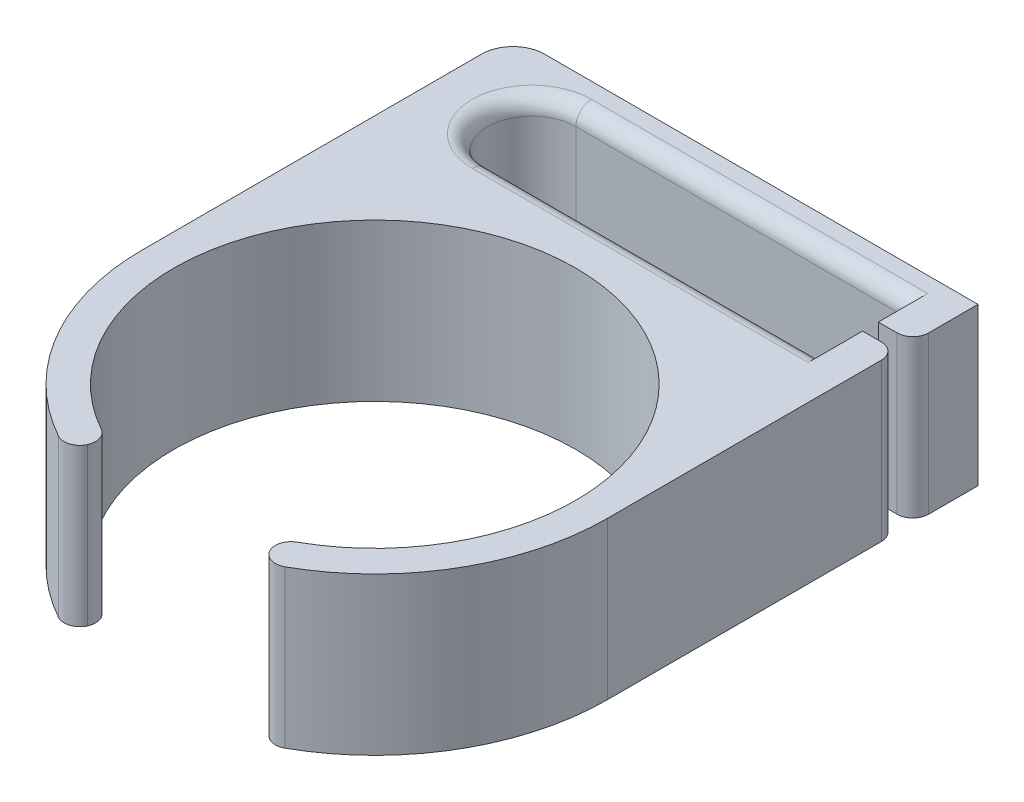
from build123d import *

# Parameters (mm, degrees)
BOSS_EXTRUDE1_DEPTH = 10
FILLET1_R           = 2
FILLET2_R           = 1


with BuildPart() as part:
    # Sketch2 → Boss-Extrude1 (new body)
    with BuildSketch(Plane(origin=(0, 0, 0), x_dir=(1, 0, 0), z_dir=(0, 1, 0))):
        with BuildLine():
            ThreePointArc((-14.8, 0), (-12.482193398, -7.952034204), (-6.254750274, -13.413355248))
            Line((-6.254750274, -13.413355248), (-5.40951375, -11.600739674))
            ThreePointArc((-5.40951375, -11.600739674), (0, 12.8), (5.40951375, -11.600739674))
            Line((5.40951375, -11.600739674), (6.254750274, -13.413355248))
            ThreePointArc((6.254750274, -13.413355248), (12.482193398, -7.952034204), (14.8, 0))
            Line((14.8, 0), (14.8, 18.453160221))
            Line((14.8, 18.453160221), (12.6, 18.453160221))
            Line((12.6, 18.453160221), (12.6, 16))
            Line((12.6, 16), (-8.8, 16))
            ThreePointArc((-8.8, 16), (-11.6, 18.8), (-8.8, 21.6))
            Line((-8.8, 21.6), (12.6, 21.6))
            Line((12.6, 21.6), (12.6, 19.453160221))
            Line((12.6, 19.453160221), (14.8, 19.453160221))
            Line((14.8, 19.453160221), (14.8, 23.6))
            Line((14.8, 23.6), (-14.8, 23.6))
            Line((-14.8, 23.6), (-14.8, 0))
        make_face()
    extrude(amount=BOSS_EXTRUDE1_DEPTH)

    # Fillet1
    fillet1_edges = [part.edges().sort_by_distance(p)[0] for p in [
        (-14.8, 5, -23.6),
    ]]
    fillet(fillet1_edges, radius=FILLET1_R)

    # Fillet2
    fillet2_edges = [part.edges().sort_by_distance(p)[0] for p in [
        (1.9, 0, -21.6),
        (1.9, 10, -21.6),
        (-11.6, 0, -18.8),
        (-11.6, 10, -18.8),
        (1.9, 0, -16),
        (1.9, 10, -16),
        (14.8, 5, -19.453160221),
        (14.8, 5, -18.453160221),
        (5.40951375, 5, 11.600739674),
        (6.254750274, 5, 13.413355248),
        (-6.254750274, 5, 13.413355248),
        (-5.40951375, 5, 11.600739674),
    ]]
    fillet(fillet2_edges, radius=FILLET2_R - 0.0001)  # a hair under: the kernel refuses the full size


solid = part.part
